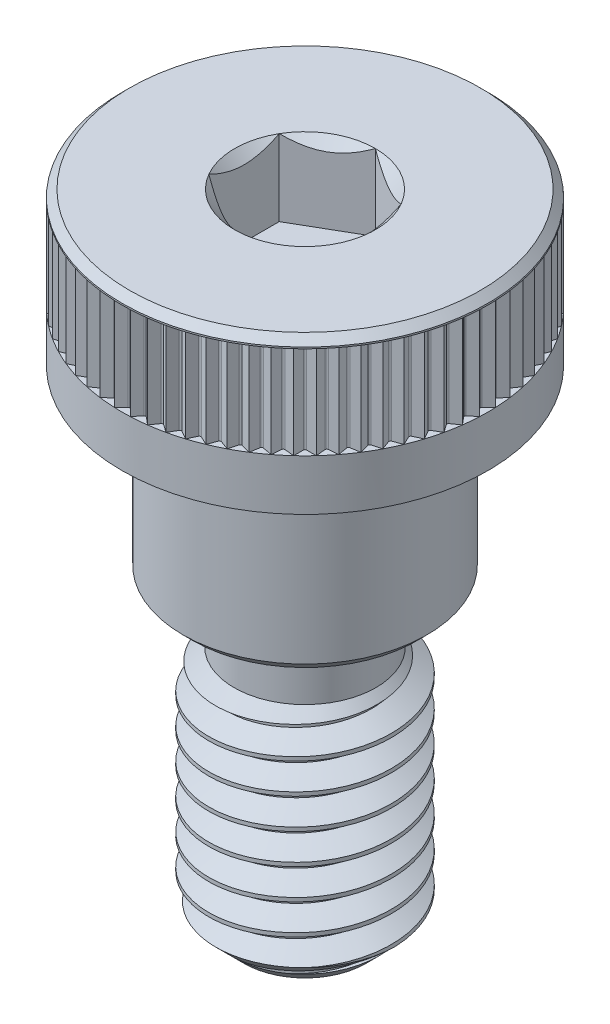
from build123d import *

# Parameters (mm, degrees)
SKETCH1_R          = 9.525
EXTRUDE1_DEPTH     = 7.9375
CUT_EXTRUDE1_DEPTH = 3.96875
SKETCH4_R          = 6.35
EXTRUDE2_DEPTH     = 9.525
SKETCH5_R          = 4.7625
EXTRUDE3_DEPTH     = 15.875
CHAMFER1_SIZE      = 1.5875
CUT_SWEEP1_PITCH   = 1.5875
CUT_SWEEP1_TO      = 15.875
CUT_EXTRUDE3_DEPTH = 4.825504756
CHAMFER2_SIZE      = 0.388468259
CIRPATTERN2_COUNT  = 72
FILLET1_R          = 0.79375
CHAMFER3_SIZE      = 0.529166667


with BuildPart() as part:
    # Sketch1 → Extrude1 (new body)
    with BuildSketch(Plane(origin=(0, 0, 0), x_dir=(1, 0, 0), z_dir=(0, 1, 0))):
        with Locations(Location((0, 0, 0), (0, 0, 270))):
            Circle(SKETCH1_R)
    extrude(amount=EXTRUDE1_DEPTH)

    # Sketch2 → Cut-Extrude1 (cut)
    with BuildSketch(Plane(origin=(0, 7.9375, 0), x_dir=(-1, 0, 0), z_dir=(0, 1, 0))):
        Polygon((0, -3.666174209), (3.175, -1.833087105), (3.175, 1.833087105), (0, 3.666174209), (-3.175, 1.833087105), (-3.175, -1.833087105), align=None)
    extrude(amount=-CUT_EXTRUDE1_DEPTH, mode=Mode.SUBTRACT)

    # Sketch4 → Extrude2 (add)
    with BuildSketch(Plane.XZ):
        with Locations(Location((0, 0, 0), (0, 0, 90))):
            Circle(SKETCH4_R)
    extrude(amount=EXTRUDE2_DEPTH)

    # Sketch5 → Extrude3 (add)
    with BuildSketch(Plane.XZ.offset(9.525)):
        with Locations(Location((0, 0, 0), (0, 0, 270))):
            Circle(SKETCH5_R)
    extrude(amount=EXTRUDE3_DEPTH)

    # Chamfer1
    chamfer1_edges = [part.edges().sort_by_distance(p)[0] for p in [
        (0, -25.4, 4.7625),
    ]]
    chamfer(chamfer1_edges, length=CHAMFER1_SIZE)

    # Cut-Sweep1: arcs per turn and ends read off the stored shape
    # Cut-Sweep1: the profile of Sketch13 profile screwed along a right-hand helix through 11 turns, 6 arcs to a turn; built about Z, then put on its axis
    cut_sweep1_z = Axis((0, 0, 0), (0, 0, 1))
    cut_sweep1_corners = [(4.7628, 0, -0.198264295), (4.7628, 0, -1.587673205), (3.731388504, 0, -0.9921875), (3.731388504, 0, -0.79375)]
    with BuildLine(mode=Mode.PRIVATE) as cut_sweep1_profile:
        Line(cut_sweep1_corners[0], cut_sweep1_corners[1])
        Line(cut_sweep1_corners[1], cut_sweep1_corners[2])
        Line(cut_sweep1_corners[2], cut_sweep1_corners[3])
        Line(cut_sweep1_corners[3], cut_sweep1_corners[0])
    cut_sweep1_cap = Face(cut_sweep1_profile.wire())
    cut_sweep1_turn_angles = [0, 30, 60, 90, 120, 150, 180, 210, 240, 270, 300, 330, 360]
    cut_sweep1_turn_weights = [1, 0.8660254037844387, 1, 0.8660254037844387, 1, 0.8660254037844387, 1, 0.8660254037844387, 1, 0.8660254037844387, 1, 0.8660254037844387, 1]
    cut_sweep1_turn_rails = [Edge.make_bspline([Vector(p[0], p[1], 0).rotate(cut_sweep1_z, cut_sweep1_turn_angles[k]) / cut_sweep1_turn_weights[k] + Vector(0, 0, p[2] + CUT_SWEEP1_PITCH * cut_sweep1_turn_angles[k] / 360) for k in range(13)], [0, 0, 0, 1, 1, 2, 2, 3, 3, 4, 4, 5, 5, 6, 6, 6], 2, cut_sweep1_turn_weights) for p in cut_sweep1_corners]
    cut_sweep1_turn_sides = [Face.make_surface_from_curves(cut_sweep1_turn_rails[p[0]], cut_sweep1_turn_rails[p[1]]) for p in [(0, 1), (1, 2), (2, 3), (3, 0)]]
    cut_sweep1 = Plane(origin=(0, -25.4, 0), x_dir=(0.7071067811865438, 0, 0.7071067811865512), z_dir=(0, 1, 0)) * split(Solid(Shell([*[p.moved(Location((0, 0, CUT_SWEEP1_PITCH * i))) for i in range(11) for p in cut_sweep1_turn_sides], cut_sweep1_cap, cut_sweep1_cap.rotate(cut_sweep1_z, 3960).moved(Location((0, 0, CUT_SWEEP1_PITCH * 3960 / 360)))])), bisect_by=Plane.XY.offset(CUT_SWEEP1_TO), keep=Keep.BOTTOM, mode=Mode.PRIVATE)
    add(cut_sweep1, mode=Mode.SUBTRACT)

    # Sketch18 → Cut-Revolve1 (revolve, cut)
    with BuildSketch(Plane.XY, mode=Mode.PRIVATE) as cut_revolve1_sk:
        Polygon((4.7625, -9.525), (3.6957, -9.525), (3.6957, -12.7), (4.7625, -13.7668), align=None)
    revolve(cut_revolve1_sk.sketch.rotate(Axis((0, -9.525, 0), (0, 1, 0)), 90), axis=Axis((0, -9.525, 0), (0, 1, 0)), mode=Mode.SUBTRACT)

    # Sketch10 → Cut-Extrude3 (cut)
    with BuildSketch(Plane(origin=(0, 2.645833333, 0), x_dir=(-1, 0, 0), z_dir=(0, 1, 0))):
        with BuildLine():
            Line((-9.515934311, -0.415474665), (-9.655390026, -0.421563433))
            Line((-9.655390026, -0.421563433), (-9.655390026, 0.421563433))
            Line((-9.655390026, 0.421563433), (-9.515934311, 0.415474665))
            Line((-9.515934311, 0.415474665), (-9.162038564, 0.061578918))
            ThreePointArc((-9.162038564, 0.061578918), (-9.136531741, 0), (-9.162038564, -0.061578918))
            Line((-9.162038564, -0.061578918), (-9.515934311, -0.415474665))
        make_face()
    cut_extrude3 = extrude(amount=CUT_EXTRUDE3_DEPTH, mode=Mode.SUBTRACT)

    # Chamfer2
    chamfer2_edges = [part.edges().sort_by_distance(p)[0] for p in [
        (0, 7.9375, -9.525),
    ]]
    chamfer(chamfer2_edges, length=CHAMFER2_SIZE)

    # CirPattern2: Cut-Extrude3 ×72 about axis
    cirpattern2_axis = Axis((0, 0, 0), (0, 1, 0))
    for i in range(1, CIRPATTERN2_COUNT):
        add(cut_extrude3.rotate(cirpattern2_axis, i * 360 / CIRPATTERN2_COUNT), mode=Mode.SUBTRACT)

    # Fillet1
    fillet1_edges = [part.edges().sort_by_distance(p)[0] for p in [
        (0, -9.525, 3.6957),
    ]]
    fillet(fillet1_edges, radius=FILLET1_R)

    # Chamfer3
    chamfer3_edges = [part.edges().sort_by_distance(p)[0] for p in [
        (0, -9.525, -6.35),
    ]]
    chamfer(chamfer3_edges, length=CHAMFER3_SIZE)

    # Extrude4 cone 1 section (through the dimple's axis) → Extrude4 (revolve, cut)
    with BuildSketch(Plane(origin=(0, 7.9375, 0), x_dir=(0, 0, 1), z_dir=(1, 0, 0))):
        Polygon((0, 0), (3.666174209, 0), (0, 3.666174209), align=None)
    revolve(axis=Axis((0, 7.9375, 0), (0, -1, 0)), mode=Mode.SUBTRACT)


solid = part.part
